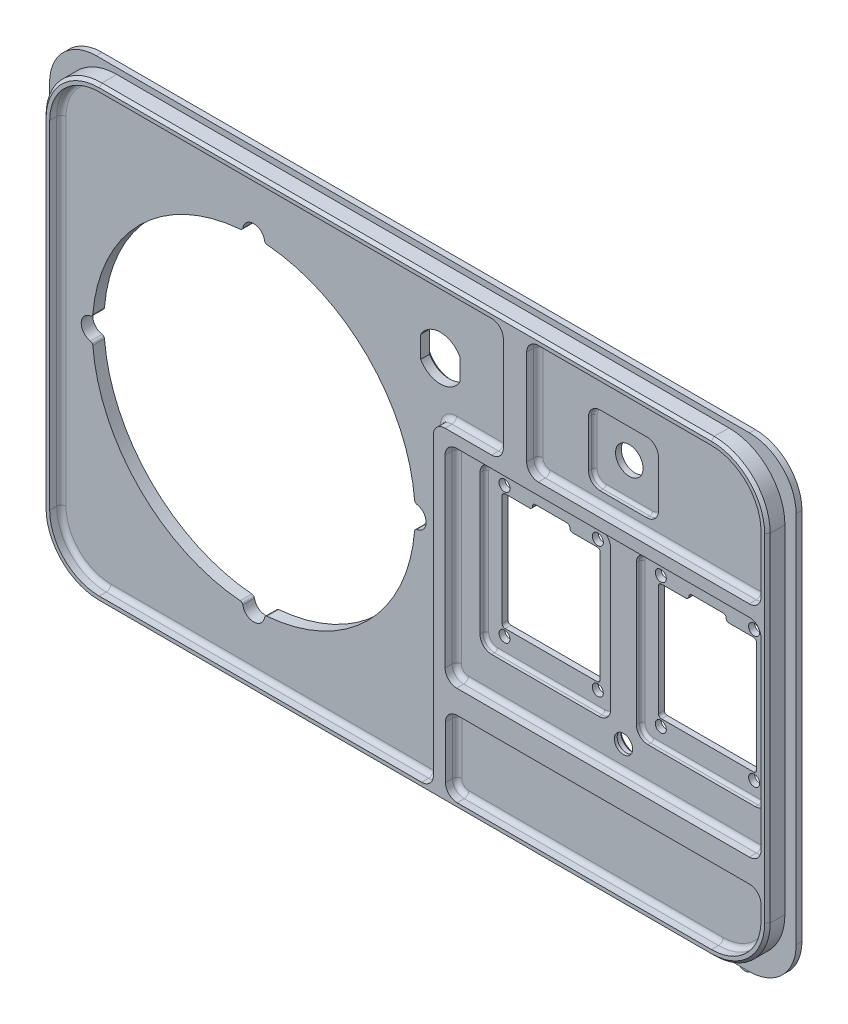
from build123d import *

# Parameters (mm, degrees)
SKETCH2_W             = 203.2
SKETCH2_H             = 127
BOSS_EXTRUDE1_DEPTH   = 3.175
SKETCH3_W             = 203.2
SKETCH3_H             = 127
CUT_EXTRUDE1_DEPTH    = 1.5875
FILLET1_R             = 12.7
BOSS_EXTRUDE2_START   = 3.175
BOSS_EXTRUDE2_DEPTH   = 3.175
BIG_BUTTON_HOLE_DEPTH = 120.979717036
SKETCH5_R             = 1.5
SKETCH5_R_2           = 3.75
SKETCH5_R_3           = 2.5
OLED_CUTOUT_DEPTH     = 120.979717036
KEY_SWITCH_DEPTH      = 120.979717036
SKETCH10_R            = 3.125
CUT_EXTRUDE4_DEPTH    = 2.38125
SKETCH11_W            = 19.05
SKETCH11_H            = 19.05
CUT_EXTRUDE5_DEPTH    = 1.5875
SKETCH12_W            = 35.56
SKETCH12_H            = 44.45
CUT_EXTRUDE6_DEPTH    = 1.5875
FILLET7_R             = 0.79375
FILLET8_R             = 3.175
FILLET9_R             = 0.79375
CHAMFER3_SIZE         = 0.762
SKETCH14_W            = 3.175
SKETCH14_H            = 0.762
BOSS_EXTRUDE3_DEPTH   = 1.27
FILLET12_R            = 1.5875
BOSS_EXTRUDE5_DEPTH   = 3.175
FILLET13_R            = 3.175
FILLET14_R            = 1.27
CHAMFER4_SIZE         = 0.762
CHAMFER5_SIZE         = 0.762
FILLET15_R            = 0.79375


# Some blends are built 0.0001 mm under size
with BuildPart() as part:
    # Sketch2 → Boss-Extrude1 (new body)
    with BuildSketch(Plane.XY):
        Rectangle(SKETCH2_W, SKETCH2_H)
    extrude(amount=BOSS_EXTRUDE1_DEPTH)

    # Sketch3 → Cut-Extrude1 (cut)
    with BuildSketch(Plane.XY.offset(3.175)):
        Rectangle(SKETCH3_W, SKETCH3_H)
        with BuildLine():
            Line((98.552, -45.212), (98.552, 46.636999944))
            ThreePointArc((98.552, 46.636999944), (94.088307345, 57.413307289), (83.312, 61.876999944))
            Line((83.312, 61.876999944), (-83.312, 61.876999944))
            ThreePointArc((-83.312, 61.876999944), (-94.088307345, 57.413307289), (-98.552, 46.636999944))
            Line((-98.552, 46.636999944), (-98.552, -45.212))
            ThreePointArc((-98.552, -45.212), (-94.088307345, -55.988307345), (-83.312, -60.452))
            Line((-83.312, -60.452), (83.312, -60.452))
            ThreePointArc((83.312, -60.452), (94.088307345, -55.988307345), (98.552, -45.212))
        make_face(mode=Mode.SUBTRACT)
    extrude(amount=-CUT_EXTRUDE1_DEPTH, mode=Mode.SUBTRACT)

    # Fillet1
    fillet1_edges = [part.edges().sort_by_distance(p)[0] for p in [
        (101.6, -63.5, 0.79375),
        (-101.6, -63.5, 0.79375),
        (-101.6, 63.5, 0.79375),
        (101.6, 63.5, 0.79375),
    ]]
    fillet(fillet1_edges, radius=FILLET1_R)

    # Sketch13 → Boss-Extrude2 (add)
    with BuildSketch(Plane.XY.offset(3.175).offset(BOSS_EXTRUDE2_START)):
        with BuildLine():
            Line((98.552, -45.212), (98.552, 46.636999944))
            ThreePointArc((98.552, 46.636999944), (94.088307345, 57.413307289), (83.312, 61.876999944))
            Line((83.312, 61.876999944), (-83.312, 61.876999944))
            ThreePointArc((-83.312, 61.876999944), (-94.088307345, 57.413307289), (-98.552, 46.636999944))
            Line((-98.552, 46.636999944), (-98.552, -45.212))
            ThreePointArc((-98.552, -45.212), (-94.088307345, -55.988307345), (-83.312, -60.452))
            Line((-83.312, -60.452), (83.312, -60.452))
            ThreePointArc((83.312, -60.452), (94.088307345, -55.988307345), (98.552, -45.212))
        make_face()
        with BuildLine():
            Line((96.802, -45.212), (96.802, 46.636999944))
            ThreePointArc((96.802, 46.636999944), (92.850870478, 56.175870422), (83.312, 60.126999944))
            Line((83.312, 60.126999944), (-83.312, 60.126999944))
            ThreePointArc((-83.312, 60.126999944), (-92.850870478, 56.175870422), (-96.802, 46.636999944))
            Line((-96.802, 46.636999944), (-96.802, -45.212))
            ThreePointArc((-96.802, -45.212), (-92.850870478, -54.750870478), (-83.312, -58.702))
            Line((-83.312, -58.702), (83.312, -58.702))
            ThreePointArc((83.312, -58.702), (92.850870478, -54.750870478), (96.802, -45.212))
        make_face(mode=Mode.SUBTRACT)
    extrude(amount=-BOSS_EXTRUDE2_DEPTH)

    # Sketch4 → big_BUTTON_HOLE (cut, through all)
    with BuildSketch(Plane(origin=(0, 0, 0), x_dir=(-1, 0, 0), z_dir=(0, 0, -1))):
        with BuildLine():
            ThreePointArc((41.4517484, 43.839592281), (13.378313821, 31.071686179), (0.610407719, 2.9982516))
            ThreePointArc((0.610407719, 2.9982516), (-2.492, 0), (0.610407719, -2.9982516))
            ThreePointArc((0.610407719, -2.9982516), (13.378313821, -31.071686179), (41.4517484, -43.839592281))
            ThreePointArc((41.4517484, -43.839592281), (44.45, -46.942), (47.4482516, -43.839592281))
            ThreePointArc((47.4482516, -43.839592281), (75.521686179, -31.071686179), (88.289592281, -2.9982516))
            ThreePointArc((88.289592281, -2.9982516), (91.392, 0), (88.289592281, 2.9982516))
            ThreePointArc((88.289592281, 2.9982516), (75.521686179, 31.071686179), (47.4482516, 43.839592281))
            ThreePointArc((47.4482516, 43.839592281), (44.45, 46.942), (41.4517484, 43.839592281))
        make_face()
    extrude(amount=-BIG_BUTTON_HOLE_DEPTH, mode=Mode.SUBTRACT)

    # Sketch5 → OLED_CUTOUT (cut, through all)
    with BuildSketch(Plane(origin=(0, 0, 0), x_dir=(-1, 0, 0), z_dir=(0, 0, -1))):
        with Locations((-22.225, -17.78)):
            Circle(SKETCH5_R)
        with Locations((-47.625, -17.78)):
            Circle(SKETCH5_R)
        with Locations((-22.225, 17.78)):
            Circle(SKETCH5_R)
        with Locations((-47.625, 17.78)):
            Circle(SKETCH5_R)
        with Locations((-64.77, -17.78)):
            Circle(SKETCH5_R)
        with Locations((-64.77, 17.78)):
            Circle(SKETCH5_R)
        with Locations((-90.17, -17.78)):
            Circle(SKETCH5_R)
        with Locations((-90.17, 17.78)):
            Circle(SKETCH5_R)
        with Locations((-56.1975, 40.64)):
            Circle(SKETCH5_R_2)
        with Locations((-56.1975, -25.4)):
            Circle(SKETCH5_R_3)
        Polygon((-82.55, 15.875), (-82.55, 17.4625), (-72.39, 17.4625), (-72.39, 15.875), (-64.135, 15.875), (-64.135, -15.875), (-90.805, -15.875), (-90.805, 15.875), align=None)
        Polygon((-48.26, 15.875), (-40.005, 15.875), (-40.005, 17.4625), (-29.845, 17.4625), (-29.845, 15.875), (-21.59, 15.875), (-21.59, -15.875), (-48.26, -15.875), align=None)
    extrude(amount=-OLED_CUTOUT_DEPTH, mode=Mode.SUBTRACT)

    # Sketch8 → Key_switch (cut, through all)
    with BuildSketch(Plane(origin=(0, 0, 0), x_dir=(-1, 0, 0), z_dir=(0, 0, -1))):
        with BuildLine():
            Line((-1.016, 37.68878669), (-1.016, 43.59121331))
            ThreePointArc((-1.016, 43.59121331), (-6.35, 46.736), (-11.684, 43.59121331))
            Line((-11.684, 43.59121331), (-11.684, 37.68878669))
            ThreePointArc((-11.684, 37.68878669), (-6.35, 34.544), (-1.016, 37.68878669))
        make_face()
    extrude(amount=-KEY_SWITCH_DEPTH, mode=Mode.SUBTRACT)

    # Sketch10 → Cut-Extrude4 (cut)
    with BuildSketch(Plane(origin=(0, 0, 0), x_dir=(-1, 0, 0), z_dir=(0, 0, -1))):
        with Locations((-56.1975, -25.4)):
            Circle(SKETCH10_R)
    extrude(amount=-CUT_EXTRUDE4_DEPTH, mode=Mode.SUBTRACT)

    # Sketch11 → Cut-Extrude5 (cut)
    with BuildSketch(Plane.XY.offset(3.175)):
        with Locations((56.1975, 40.64)):
            Rectangle(SKETCH11_W, SKETCH11_H)
    extrude(amount=-CUT_EXTRUDE5_DEPTH, mode=Mode.SUBTRACT)

    # Sketch12 → Cut-Extrude6 (cut)
    with BuildSketch(Plane.XY.offset(3.175)):
        with Locations((34.925, 0)):
            Rectangle(SKETCH12_W, SKETCH12_H)
        with Locations((77.47, 0)):
            Rectangle(SKETCH12_W, SKETCH12_H)
    extrude(amount=-CUT_EXTRUDE6_DEPTH, mode=Mode.SUBTRACT)

    # Fillet7
    fillet7_edges = [part.edges().sort_by_distance(p)[0] for p in [
        (90.805, 15.875, 0.79375),
        (82.55, 15.875, 0.79375),
        (82.55, 17.4625, 0.79375),
        (64.135, 15.875, 0.79375),
        (72.39, 17.4625, 0.79375),
        (72.39, 15.875, 0.79375),
        (48.26, 15.875, 0.79375),
        (40.005, 17.4625, 0.79375),
        (29.845, 17.4625, 0.79375),
        (21.59, 15.875, 0.79375),
        (40.005, 15.875, 0.79375),
        (29.845, 15.875, 0.79375),
        (21.59, -15.875, 0.79375),
        (48.26, -15.875, 0.79375),
        (64.135, -15.875, 0.79375),
        (90.805, -15.875, 0.79375),
    ]]
    fillet(fillet7_edges, radius=FILLET7_R - 0.0001)  # a hair under: the kernel refuses the full size

    # Fillet8
    fillet8_edges = [part.edges().sort_by_distance(p)[0] for p in [
        (65.7225, 50.165, 2.38125),
        (65.7225, 31.115, 2.38125),
        (46.6725, 31.115, 2.38125),
        (46.6725, 50.165, 2.38125),
        (52.705, 22.225, 2.38125),
        (52.705, -22.225, 2.38125),
        (17.145, -22.225, 2.38125),
        (17.145, 22.225, 2.38125),
        (59.69, -22.225, 2.38125),
        (59.69, 22.225, 2.38125),
        (95.25, 22.225, 2.38125),
        (95.25, -22.225, 2.38125),
    ]]
    fillet(fillet8_edges, radius=FILLET8_R)

    # Fillet9
    fillet9_edges = [part.edges().sort_by_distance(p)[0] for p in [
        (65.7225, 40.64, 1.5875),
        (56.1975, 31.115, 1.5875),
        (56.1975, 50.165, 1.5875),
        (46.6725, 40.64, 1.5875),
        (47.60243597, 49.23506403, 1.5875),
        (64.79256403, 49.23506403, 1.5875),
        (47.60243597, 32.04493597, 1.5875),
        (64.79256403, 32.04493597, 1.5875),
        (77.47, 22.225, 1.5875),
        (95.25, 0, 1.5875),
        (59.69, 0, 1.5875),
        (77.47, -22.225, 1.5875),
        (94.32006403, -21.29506403, 1.5875),
        (60.61993597, -21.29506403, 1.5875),
        (60.61993597, 21.29506403, 1.5875),
        (94.32006403, 21.29506403, 1.5875),
        (52.705, 0, 1.5875),
        (34.925, -22.225, 1.5875),
        (34.925, 22.225, 1.5875),
        (17.145, 0, 1.5875),
        (18.07493597, 21.29506403, 1.5875),
        (51.77506403, 21.29506403, 1.5875),
        (18.07493597, -21.29506403, 1.5875),
        (51.77506403, -21.29506403, 1.5875),
    ]]
    fillet(fillet9_edges, radius=FILLET9_R)

    # Chamfer3
    chamfer3_edges = [part.edges().sort_by_distance(p)[0] for p in [
        (94.088307345, -55.988307345, 6.35),
        (98.552, 0.712499972, 6.35),
        (94.088307345, 57.413307289, 6.35),
        (0, 61.876999944, 6.35),
        (-94.088307345, 57.413307289, 6.35),
        (-98.552, 0.712499972, 6.35),
        (-94.088307345, -55.988307345, 6.35),
        (0, -60.452, 6.35),
    ]]
    chamfer(chamfer3_edges, length=CHAMFER3_SIZE)

    # Sketch14 → Boss-Extrude3 (add)
    with BuildSketch(Plane(origin=(0, 0, 0), x_dir=(-1, 0, 0), z_dir=(0, 0, -1))):
        with Locations((-87.3125, -63.881)):
            Rectangle(SKETCH14_W, SKETCH14_H)
    boss_extrude3 = extrude(amount=-BOSS_EXTRUDE3_DEPTH)

    # Mirror1: Boss-Extrude3 across plane
    add(boss_extrude3.mirror(Plane(origin=(0, 0, 0), x_dir=(0, 0, 1), z_dir=(1, 0, 0))))

    # Fillet12
    # the kernel refuses this fillet: 1.5875 mm, written as the material it takes off along each edge
    with BuildSketch(Plane(origin=(-85.725, -64.262, -3.389972345), x_dir=(0, 1, 0), z_dir=(0, 0, 1)), Plane(origin=(88.9, -64.262, -3.389972345), x_dir=(0, 1, 0), z_dir=(0, 0, 1))) as fillet12_piece_1:
        with BuildLine():
            CenterArc((1.5875, 1.355988938), FILLET12_R, 180, 58.667748502)
            Line((0, 1.355988938), (-0.03175, 1.355988938))
            Line((-0.03175, 1.355988938), (-0.03175, 0))
            Line((-0.03175, 0), (0, -0.03175))
            ThreePointArc((0, -0.03175), (0.381, -0.03175), (0.74549, -0.027119779))
            Line((0.74549, -0.027119779), (0.762, 0))
        make_face()
    extrude(amount=8.04994469, mode=Mode.SUBTRACT)
    with BuildSketch(Plane(origin=(-88.9, -64.262, -3.389972345), x_dir=(0, 1, 0), z_dir=(0, 0, 1)), Plane(origin=(85.725, -64.262, -3.389972345), x_dir=(0, 1, 0), z_dir=(0, 0, 1))) as fillet12_piece_2:
        with BuildLine():
            CenterArc((1.5875, -1.355988938), FILLET12_R, 121.332251498, 58.667748502)
            Line((0, -1.355988938), (-0.03175, -1.355988938))
            Line((-0.03175, -1.355988938), (-0.03175, 0))
            Line((-0.03175, 0), (0, 0.03175))
            ThreePointArc((0, 0.03175), (0.381, 0.03175), (0.74549, 0.027119779))
            Line((0.74549, 0.027119779), (0.762, 0))
        make_face()
    extrude(amount=8.04994469, mode=Mode.SUBTRACT)

    # Sketch15 → Boss-Extrude5 (add)
    with BuildSketch(Plane.XY.offset(3.175)):
        Polygon((96.802, 27.94), (33.02, 27.94), (33.02, 60.126999944), (26.67, 60.126999944), (26.67, 27.94), (7.62, 27.94), (7.62, -58.702), (10.922, -58.702), (10.922, -38.1), (96.802, -38.1), (96.802, -31.75), (10.795, -31.75), (10.795, 24.765), (96.802, 24.765), align=None)
    extrude(amount=BOSS_EXTRUDE5_DEPTH)

    # Fillet13
    fillet13_edges = [part.edges().sort_by_distance(p)[0] for p in [
        (96.802, 24.765, 4.7625),
        (96.802, 27.94, 4.7625),
        (33.02, 27.94, 4.7625),
        (33.02, 60.126999944, 4.7625),
        (26.67, 60.126999944, 4.7625),
        (26.67, 27.94, 4.7625),
        (7.62, 27.94, 4.7625),
        (7.62, -58.702, 4.7625),
        (10.922, -58.702, 4.7625),
        (10.922, -38.1, 4.7625),
        (96.802, -38.1, 4.7625),
        (96.802, -31.75, 4.7625),
        (10.795, -31.75, 4.7625),
        (10.795, 24.765, 4.7625),
    ]]
    fillet(fillet13_edges, radius=FILLET13_R)

    # Fillet14
    fillet14_edges = [part.edges().sort_by_distance(p)[0] for p in [
        (26.67, 44.033499972, 3.175),
        (-29.9085, 60.126999944, 3.175),
        (7.62, -15.381, 3.175),
        (17.145, 27.94, 3.175),
        (25.74006403, 28.86993597, 3.175),
        (25.74006403, 59.197063974, 3.175),
        (6.69006403, -57.77206403, 3.175),
        (10.922, -48.401, 3.175),
        (48.7045, -58.702, 3.175),
        (53.862, -38.1, 3.175),
        (11.85193597, -57.77206403, 3.175),
        (11.85193597, -39.02993597, 3.175),
        (95.87206403, -39.02993597, 3.175),
        (64.911, 27.94, 3.175),
        (96.802, 38.875999972, 3.175),
        (33.02, 44.033499972, 3.175),
        (95.87206403, 28.86993597, 3.175),
        (33.94993597, 28.86993597, 3.175),
        (33.94993597, 59.197063974, 3.175),
        (53.7985, -31.75, 3.175),
        (96.802, -3.4925, 3.175),
        (53.7985, 24.765, 3.175),
        (10.795, -3.4925, 3.175),
        (11.72493597, 23.83506403, 3.175),
        (11.72493597, -30.82006403, 3.175),
        (95.87206403, 23.83506403, 3.175),
        (95.87206403, -30.82006403, 3.175),
        (92.850870478, 56.175870422, 3.175),
        (8.54993597, 27.01006403, 3.175),
        (59.7535, 60.126999944, 3.175),
        (-92.850870478, 56.175870422, 3.175),
        (-96.802, 0.712499972, 3.175),
        (-92.850870478, -54.750870478, 3.175),
        (-39.4335, -58.702, 3.175),
        (92.850870478, -54.750870478, 3.175),
        (96.802, -43.2435, 3.175),
    ]]
    fillet(fillet14_edges, radius=FILLET14_R)

    # Chamfer4
    chamfer4_edges = [part.edges().sort_by_distance(p)[0] for p in [
        (59.3225, -25.4, 0),
    ]]
    chamfer(chamfer4_edges, length=CHAMFER4_SIZE)

    # Chamfer5
    chamfer5_edges = [part.edges().sort_by_distance(p)[0] for p in [
        (6.35, 46.736, 0),
        (11.684, 40.64, 0),
        (6.35, 34.544, 0),
        (1.016, 40.64, 0),
    ]]
    chamfer(chamfer5_edges, length=CHAMFER5_SIZE)

    # Fillet15
    fillet15_edges = [part.edges().sort_by_distance(p)[0] for p in [
        (-47.4482516, 43.839592281, 1.5875),
        (-88.289592281, 2.9982516, 1.5875),
        (-88.289592281, -2.9982516, 1.5875),
        (-47.4482516, -43.839592281, 1.5875),
        (-41.4517484, -43.839592281, 1.5875),
        (-0.610407719, -2.9982516, 1.5875),
        (-0.610407719, 2.9982516, 1.5875),
        (-41.4517484, 43.839592281, 1.5875),
    ]]
    fillet(fillet15_edges, radius=FILLET15_R)


solid = part.part
